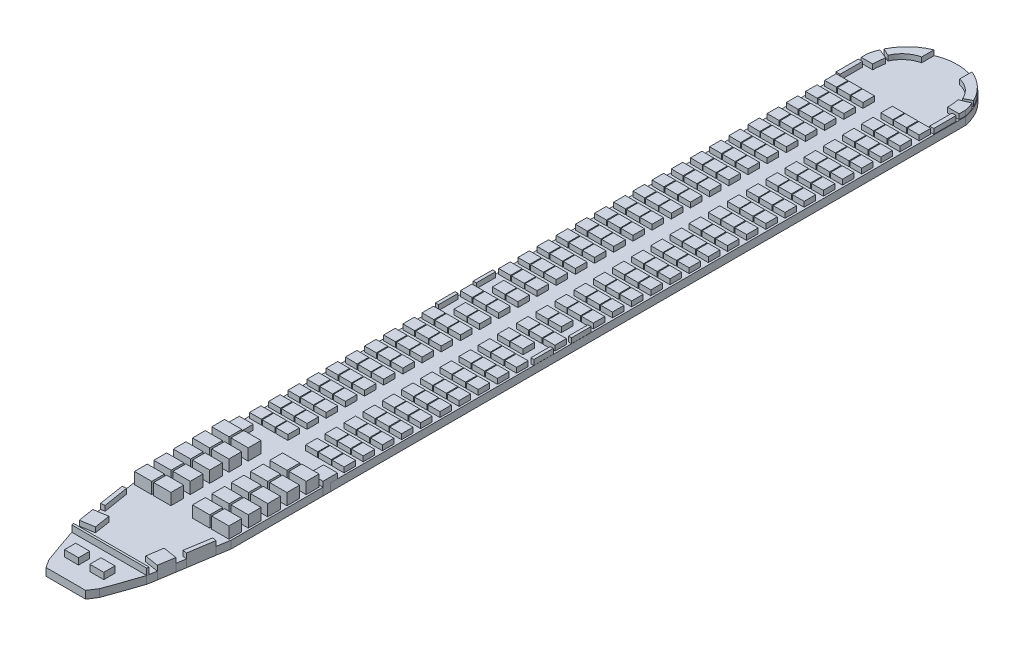
from build123d import *

# Parameters (mm, degrees)
BOSS_EXTRUDE3_DEPTH = 304.8
SKETCH5_W           = 685.8
SKETCH5_H           = 508
SKETCH5_H_2         = 502.441597217
BOSS_EXTRUDE4_DEPTH = 457.2
SKETCH6_W           = 555.14687008
SKETCH6_H           = 574.557168937
SKETCH6_W_2         = 477.661828048
SKETCH6_H_2         = 457.2
SKETCH6_W_3         = 469.71585823
SKETCH6_W_4         = 508
SKETCH6_W_5         = 162.92679119
SKETCH6_H_3         = 889
BOSS_EXTRUDE5_DEPTH = 508
SKETCH7_W           = 555.434575437
SKETCH7_H           = 444.34766035
BOSS_EXTRUDE6_DEPTH = 254


with BuildPart() as part:
    # Sketch4 → Boss-Extrude3 (new body)
    with BuildSketch(Plane(origin=(0, 0, 0), x_dir=(1, 0, 0), z_dir=(0, 1, 0))):
        with BuildLine():
            Line((-788.810799718, -16868.093798918), (788.790469891, -16868.122355126))
            add(Edge.make_bspline(
                [(788.790469891, -16868.122355126), (788.940224397, -16867.911972884), (789.076090363, -16867.721096198), (789.258988166, -16867.464001819), (789.317523873, -16867.381692927), (789.442177508, -16867.206365317), (789.506892185, -16867.115320405), (789.826325262, -16866.665819678), (790.07878684, -16866.310228279), (790.836026476, -16865.242597554), (791.342596004, -16864.526988048), (792.86067741, -16862.378362539), (793.871055668, -16860.942832845), (796.900901382, -16856.621793359), (798.918545553, -16853.722609281), (804.965696638, -16844.970348146), (808.989584152, -16839.062251822), (821.058051486, -16821.109306602), (829.09893792, -16808.835415911), (845.277497053, -16783.650061534), (853.414891385, -16770.738929993), (869.89778139, -16744.281230003), (878.243079484, -16730.735059441), (895.25564514, -16703.044013921), (903.923103805, -16688.899116194), (921.692389055, -16660.082729354), (930.794825428, -16645.410780174), (949.537820712, -16615.646693342), (959.179083326, -16600.554120659), (979.087195904, -16570.083058174), (989.354409106, -16554.704765976), (999.964886864, -16539.261683361)],
                knots=[0, 0, 0, 0, 0.001953125, 0.001953125, 0.002929688, 0.002929688, 0.00390625, 0.00390625, 0.0078125, 0.0078125, 0.015625, 0.015625, 0.03125, 0.03125, 0.0625, 0.0625, 0.125, 0.125, 0.25, 0.25, 0.375, 0.375, 0.5, 0.5, 0.625, 0.625, 0.75, 0.75, 0.875, 0.875, 1, 1, 1, 1], degree=3))
            add(Edge.make_bspline(
                [(999.964886864, -16539.261683361), (1005.469501209, -16525.619062134), (1010.936059612, -16511.929752086), (1021.791388692, -16484.476524628), (1027.181317695, -16470.709753397), (1043.249119015, -16429.282762881), (1053.82117976, -16401.505563933), (1074.725214018, -16345.654468086), (1085.055878667, -16317.584152693), (1105.518671536, -16261.165660069), (1115.650750581, -16232.817545336), (1135.754714917, -16175.87252076), (1145.726299281, -16147.27657481), (1165.552273349, -16089.853455464), (1175.407320544, -16061.024348403), (1195.039760803, -16003.162226824), (1204.817664081, -15974.12777229), (1224.339249807, -15915.870454514), (1234.083292789, -15886.646513956), (1263.324076642, -15798.728848378), (1282.832002714, -15739.782851529), (1312.35844478, -15650.984196085), (1322.244621457, -15621.321265719), (1342.144312918, -15561.889155996), (1352.157331105, -15532.121450588), (1382.446433277, -15442.68476221), (1402.970889639, -15382.889141568), (1429.223854494, -15308.033171222), (1434.504218751, -15293.056542419), (1445.128796407, -15263.09510607), (1450.472611947, -15248.111408218), (1458.540852856, -15225.627655327), (1461.240115841, -15218.12864994), (1466.654125511, -15203.135336201), (1469.368028937, -15195.64335827), (1477.538606754, -15173.161290737), (1483.023616655, -15158.166666964), (1488.546373015, -15143.172978275)],
                knots=[0, 0, 0, 0, 0.03125, 0.03125, 0.0625, 0.0625, 0.125, 0.125, 0.1875, 0.1875, 0.25, 0.25, 0.3125, 0.3125, 0.375, 0.375, 0.4375, 0.4375, 0.5, 0.5, 0.625, 0.625, 0.6875, 0.6875, 0.75, 0.75, 0.875, 0.875, 0.90625, 0.90625, 0.9375, 0.9375, 0.953125, 0.953125, 0.96875, 0.96875, 1, 1, 1, 1], degree=3))
            add(Edge.make_bspline(
                [(1488.546373015, -15143.172978275), (1493.840802249, -15113.383565061), (1499.090128379, -15083.581353073), (1509.506146765, -15023.941400002), (1514.672510127, -14994.105426883), (1530.055031318, -14904.551642146), (1540.15456974, -14844.788189318), (1570.053480056, -14665.330205209), (1589.453191911, -14545.468526341), (1646.586525662, -14185.328356714), (1683.256025742, -13944.496344363), (1756.572562233, -13461.890440047), (1793.220505775, -13220.11318668), (1850.243527614, -12857.124946842), (1869.592488654, -12736.075321596), (1909.309539221, -12493.939565663), (1929.677667902, -12372.853342471), (1950.720285923, -12251.787750663)],
                knots=[0, 0, 0, 0, 0.03125, 0.03125, 0.0625, 0.0625, 0.125, 0.125, 0.25, 0.25, 0.5, 0.5, 0.75, 0.75, 0.875, 0.875, 1, 1, 1, 1], degree=3))
            Line((1950.720285923, -12251.787750663), (1964.85927528, 16931.630930018))
            ThreePointArc((1964.85927528, 16931.630930018), (7.114927686, 18555.0286107), (-1950.629419908, 16931.630930018))
            Line((-1950.629419908, 16931.630930018), (-1950.720285923, -12251.787739666))
            add(Edge.make_bspline(
                [(-1950.720285923, -12251.787739666), (-1929.677422256, -12372.855225305), (-1909.309575273, -12493.939359238), (-1869.592506183, -12736.075197756), (-1850.243553068, -12857.124790715), (-1793.220521061, -13220.113075439), (-1756.572579528, -13461.890326035), (-1683.256037912, -13944.496265516), (-1646.586533763, -14185.328298768), (-1589.453200269, -14545.468477249), (-1570.053488291, -14665.330175444), (-1530.188270947, -14904.607471019), (-1509.722694643, -15024.023194989), (-1488.546377942, -15143.172968001)],
                knots=[0, 0, 0, 0, 0.125, 0.125, 0.25, 0.25, 0.5, 0.5, 0.75, 0.75, 0.875, 0.875, 1, 1, 1, 1], degree=3))
            add(Edge.make_bspline(
                [(-1488.546377942, -15143.172968001), (-1466.455522421, -15203.147143549), (-1444.975296394, -15263.120541687), (-1402.97072655, -15382.889615583), (-1382.446131284, -15442.685654366), (-1342.061332039, -15561.932592068), (-1322.20037424, -15621.385276304), (-1282.83194565, -15739.783041012), (-1263.323845445, -15798.729535593), (-1234.083007528, -15886.647376011), (-1224.338830774, -15915.871706985), (-1204.817585262, -15974.12800532), (-1195.039852061, -16003.1619602), (-1175.407136093, -16061.024889247), (-1165.552038943, -16089.854134348), (-1145.726552787, -16147.275840717), (-1135.754595785, -16175.872863907), (-1105.598236332, -16261.291553641), (-1085.176591865, -16317.730658288), (-1053.820721926, -16401.506772349), (-1043.248965647, -16429.283158333), (-1027.181389759, -16470.709567592), (-1021.791165632, -16484.477101067), (-1010.934766478, -16511.933010335), (-1005.469177826, -16525.61986332), (-999.96488697, -16539.261683105)],
                knots=[0, 0, 0, 0, 0.125, 0.125, 0.25, 0.25, 0.375, 0.375, 0.5, 0.5, 0.5625, 0.5625, 0.625, 0.625, 0.6875, 0.6875, 0.75, 0.75, 0.875, 0.875, 0.9375, 0.9375, 0.96875, 0.96875, 1, 1, 1, 1], degree=3))
            add(Edge.make_bspline(
                [(-999.96488697, -16539.261683105), (-989.354214446, -16554.705050951), (-979.0870972, -16570.083218229), (-959.179297814, -16600.55378496), (-949.538081339, -16615.646278741), (-930.794585603, -16645.411159258), (-921.692516307, -16660.08252605), (-903.923042253, -16688.899211773), (-895.25556778, -16703.044130967), (-878.243061091, -16730.735095132), (-869.897784292, -16744.281226612), (-853.41488483, -16770.738939359), (-845.277447311, -16783.650139102), (-829.098950978, -16808.835395957), (-821.058104775, -16821.109227031), (-808.989532722, -16839.062328265), (-804.965644421, -16844.97042752), (-798.918636468, -16853.722475397), (-796.90109459, -16856.621508099), (-793.365869922, -16861.663300342), (-791.84921569, -16863.814088979), (-790.077825126, -16866.311580325), (-789.824739986, -16866.668060324), (-789.444965093, -16867.202467166), (-789.223411997, -16867.514077762), (-789.001854934, -16867.825427878), (-788.89107346, -16867.981049968), (-788.875171087, -16868.003387727), (-788.843817629, -16868.047426577), (-788.829522774, -16868.067503411), (-788.810799718, -16868.093798918)],
                knots=[0, 0, 0, 0, 0.125, 0.125, 0.25, 0.25, 0.375, 0.375, 0.5, 0.5, 0.625, 0.625, 0.75, 0.75, 0.875, 0.875, 0.9375, 0.9375, 0.96875, 0.96875, 0.9921875, 0.9921875, 0.99609375, 0.99609375, 0.998046875, 0.999511719, 0.999511719, 0.999755859, 0.999755859, 1, 1, 1, 1], degree=3))
        make_face()
    extrude(amount=BOSS_EXTRUDE3_DEPTH)

    # Sketch5 → Boss-Extrude4 (add)
    with BuildSketch(Plane(origin=(0, 304.8, 0), x_dir=(1, 0, 0), z_dir=(0, 1, 0))):
        with Locations((-1536.076796996, -8934.76137586)):
            Rectangle(SKETCH5_W, SKETCH5_H)
        with Locations((-1536.076796996, -9702.713518589)):
            Rectangle(SKETCH5_W, SKETCH5_H)
        with Locations((-774.074929647, -8934.76137586)):
            Rectangle(SKETCH5_W, SKETCH5_H)
        with Locations((-1536.076796996, -10467.886459926)):
            Rectangle(SKETCH5_W, SKETCH5_H_2)
        with Locations((-774.074929647, -9702.713518589)):
            Rectangle(SKETCH5_W, SKETCH5_H)
        with Locations((-774.074929647, -10467.886459926)):
            Rectangle(SKETCH5_W, SKETCH5_H_2)
        with Locations((-1536.076796996, -11238.617804047)):
            Rectangle(SKETCH5_W, SKETCH5_H)
        with Locations((-1536.076796996, -12006.569946776)):
            Rectangle(SKETCH5_W, SKETCH5_H)
        with Locations((-774.074929647, -11238.617804047)):
            Rectangle(SKETCH5_W, SKETCH5_H)
        with Locations((-774.074929647, -12006.569946776)):
            Rectangle(SKETCH5_W, SKETCH5_H)
        with Locations((770.245070353, -8934.76137586)):
            Rectangle(SKETCH5_W, SKETCH5_H)
        with Locations((770.245070353, -9702.713518589)):
            Rectangle(SKETCH5_W, SKETCH5_H)
        with Locations((1532.246937703, -8934.76137586)):
            Rectangle(SKETCH5_W, SKETCH5_H)
        with Locations((770.245070353, -10467.886459926)):
            Rectangle(SKETCH5_W, SKETCH5_H_2)
        with Locations((1532.246937703, -9702.713518589)):
            Rectangle(SKETCH5_W, SKETCH5_H)
        with Locations((770.245070353, -11238.617804047)):
            Rectangle(SKETCH5_W, SKETCH5_H)
        with Locations((1532.246937703, -10467.886459926)):
            Rectangle(SKETCH5_W, SKETCH5_H_2)
        with Locations((770.245070353, -12006.569946776)):
            Rectangle(SKETCH5_W, SKETCH5_H)
        with Locations((1532.246937703, -11238.617804047)):
            Rectangle(SKETCH5_W, SKETCH5_H)
        with Locations((1532.246937703, -12006.569946776)):
            Rectangle(SKETCH5_W, SKETCH5_H)
    extrude(amount=BOSS_EXTRUDE4_DEPTH)

    # Sketch6 → Boss-Extrude5 (add)
    with BuildSketch(Plane(origin=(0, 0, 0), x_dir=(1, 0, 0), z_dir=(0, 1, 0))):
        with BuildLine():
            Line((-1096.996372185, -14059.412556752), (-1652.936881784, -14145.735054556))
            add(Edge.make_bspline(
                [(-1652.936881784, -14145.735054556), (-1638.441172727, -14239.091387896), (-1623.814093179, -14332.352073131), (-1589.89619163, -14545.241668657), (-1570.465580892, -14664.797558908), (-1550.505259066, -14784.131230852)],
                knots=[0.652996975, 0.652996975, 0.652996975, 0.652996975, 0.75, 0.75, 0.874694016, 0.874694016, 0.874694016, 0.874694016], degree=3))
            Line((-1550.505259066, -14784.131230852), (-998.796019918, -14691.849699677))
            Line((-998.796019918, -14691.849699677), (-1096.996372185, -14059.412556752))
        make_face()
        with BuildLine():
            add(Edge.make_bspline(
                [(-1866.570853309, -12765.872272948), (-1855.131474123, -12836.711221148), (-1843.842752296, -12907.538994798), (-1794.495192893, -13220.31545729), (-1757.686992517, -13462.068361946), (-1716.805347843, -13729.975608952), (-1712.741785405, -13756.598502636), (-1708.676197232, -13783.215299013)],
                knots=[0.176839669, 0.176839669, 0.176839669, 0.176839669, 0.25, 0.25, 0.5, 0.5, 0.527591162, 0.527591162, 0.527591162, 0.527591162], degree=3))
            Line((-1708.676197232, -13783.215299013), (-1546.116197232, -13758.385037546))
            Line((-1546.116197232, -13758.385037546), (-1710.462314607, -12740.663192156))
            Line((-1710.462314607, -12740.663192156), (-1866.570853309, -12765.872272948))
        make_face()
        with Locations((-1675.063361956, -8311.235137432)):
            Rectangle(SKETCH6_W, SKETCH6_H)
        with Locations((-593.807425389, -7461.005527647)):
            Rectangle(SKETCH6_W_2, SKETCH6_H_2)
        with Locations((-593.807425389, -6699.005527647)):
            Rectangle(SKETCH6_W_2, SKETCH6_H_2)
        with Locations((-1644.118867881, -7461.005527647)):
            Rectangle(SKETCH6_W_3, SKETCH6_H_2)
        with Locations((-1116.976796996, -7461.005527647)):
            Rectangle(SKETCH6_W_4, SKETCH6_H_2)
        with Locations((-593.807425389, -5937.005527647)):
            Rectangle(SKETCH6_W_2, SKETCH6_H_2)
        with Locations((-593.807425389, -5175.005527647)):
            Rectangle(SKETCH6_W_2, SKETCH6_H_2)
        with Locations((-1116.976796996, -6699.005527647)):
            Rectangle(SKETCH6_W_4, SKETCH6_H_2)
        with Locations((-1644.118867881, -6699.005527647)):
            Rectangle(SKETCH6_W_3, SKETCH6_H_2)
        with Locations((-593.807425389, -4413.005527647)):
            Rectangle(SKETCH6_W_2, SKETCH6_H_2)
        with Locations((-1116.976796996, -5937.005527647)):
            Rectangle(SKETCH6_W_4, SKETCH6_H_2)
        with Locations((-593.807425389, -3651.005527647)):
            Rectangle(SKETCH6_W_2, SKETCH6_H_2)
        with Locations((-1116.976796996, -5175.005527647)):
            Rectangle(SKETCH6_W_4, SKETCH6_H_2)
        with Locations((-1644.118867881, -5937.005527647)):
            Rectangle(SKETCH6_W_3, SKETCH6_H_2)
        with Locations((-593.807425389, -2889.005527647)):
            Rectangle(SKETCH6_W_2, SKETCH6_H_2)
        with Locations((-1116.976796996, -4413.005527647)):
            Rectangle(SKETCH6_W_4, SKETCH6_H_2)
        with Locations((-593.807425389, -2127.005527647)):
            Rectangle(SKETCH6_W_2, SKETCH6_H_2)
        with Locations((-1116.976796996, -3651.005527647)):
            Rectangle(SKETCH6_W_4, SKETCH6_H_2)
        with Locations((-1644.118867881, -5175.005527647)):
            Rectangle(SKETCH6_W_3, SKETCH6_H_2)
        with Locations((-593.807425389, -1365.005527647)):
            Rectangle(SKETCH6_W_2, SKETCH6_H_2)
        with Locations((-1116.976796996, -2889.005527647)):
            Rectangle(SKETCH6_W_4, SKETCH6_H_2)
        with Locations((-1644.118867881, -4413.005527647)):
            Rectangle(SKETCH6_W_3, SKETCH6_H_2)
        with Locations((-593.807425389, -603.005527647)):
            Rectangle(SKETCH6_W_2, SKETCH6_H_2)
        with Locations((-1116.976796996, -2127.005527647)):
            Rectangle(SKETCH6_W_4, SKETCH6_H_2)
        with Locations((-1644.118867881, -3651.005527647)):
            Rectangle(SKETCH6_W_3, SKETCH6_H_2)
        with Locations((-1116.976796996, -1365.005527647)):
            Rectangle(SKETCH6_W_4, SKETCH6_H_2)
        with Locations((-1644.118867881, -2889.005527647)):
            Rectangle(SKETCH6_W_3, SKETCH6_H_2)
        with Locations((-593.807425389, 158.994472353)):
            Rectangle(SKETCH6_W_2, SKETCH6_H_2)
        with Locations((-1116.976796996, -603.005527647)):
            Rectangle(SKETCH6_W_4, SKETCH6_H_2)
        with Locations((-1644.118867881, -2127.005527647)):
            Rectangle(SKETCH6_W_3, SKETCH6_H_2)
        with Locations((-1644.118867881, -1365.005527647)):
            Rectangle(SKETCH6_W_3, SKETCH6_H_2)
        with Locations((-593.807425389, 920.994472353)):
            Rectangle(SKETCH6_W_2, SKETCH6_H_2)
        with Locations((-1116.976796996, 158.994472353)):
            Rectangle(SKETCH6_W_4, SKETCH6_H_2)
        with Locations((-1644.118867881, -603.005527647)):
            Rectangle(SKETCH6_W_3, SKETCH6_H_2)
        with Locations((-593.807425389, 1682.994472353)):
            Rectangle(SKETCH6_W_2, SKETCH6_H_2)
        with Locations((-1116.976796996, 920.994472353)):
            Rectangle(SKETCH6_W_4, SKETCH6_H_2)
        with Locations((-593.807425389, 2444.994472353)):
            Rectangle(SKETCH6_W_2, SKETCH6_H_2)
        with Locations((-1116.976796996, 1682.994472353)):
            Rectangle(SKETCH6_W_4, SKETCH6_H_2)
        with Locations((-1644.118867881, 920.994472353)):
            Rectangle(SKETCH6_W_3, SKETCH6_H_2)
        Polygon((-1952.636796996, -69.605527647), (-1952.636796996, -219.786775868), (-1831.0610289, -219.786775868), (-1831.0610289, 554.001006805), (-1952.636796996, 554.001006805), (-1952.636796996, 387.594472353), align=None)
        with Locations((-593.807425389, 3206.994472353)):
            Rectangle(SKETCH6_W_2, SKETCH6_H_2)
        with Locations((-1116.976796996, 2444.994472353)):
            Rectangle(SKETCH6_W_4, SKETCH6_H_2)
        with Locations((-593.807425389, 5492.994472353)):
            Rectangle(SKETCH6_W_2, SKETCH6_H_2)
        with Locations((-593.807425389, 3968.994472353)):
            Rectangle(SKETCH6_W_2, SKETCH6_H_2)
        with Locations((-593.807425389, 6254.994472353)):
            Rectangle(SKETCH6_W_2, SKETCH6_H_2)
        with Locations((-593.807425389, 4730.994472353)):
            Rectangle(SKETCH6_W_2, SKETCH6_H_2)
        with Locations((-1116.976796996, 3206.994472353)):
            Rectangle(SKETCH6_W_4, SKETCH6_H_2)
        with Locations((-1644.118867881, 2444.994472353)):
            Rectangle(SKETCH6_W_3, SKETCH6_H_2)
        with Locations((-593.807425389, 7016.994472353)):
            Rectangle(SKETCH6_W_2, SKETCH6_H_2)
        with Locations((-1116.976796996, 5492.994472353)):
            Rectangle(SKETCH6_W_4, SKETCH6_H_2)
        with Locations((-1116.976796996, 3968.994472353)):
            Rectangle(SKETCH6_W_4, SKETCH6_H_2)
        Polygon((-1952.636796996, 1454.394472353), (-1952.636796996, 1275.769351062), (-1831.0610289, 1275.769351062), (-1831.0610289, 2049.557133735), (-1952.636796996, 2049.557133735), (-1952.636796996, 1911.594472353), align=None)
        with Locations((-593.807425389, 7778.994472353)):
            Rectangle(SKETCH6_W_2, SKETCH6_H_2)
        with Locations((-1116.976796996, 6254.994472353)):
            Rectangle(SKETCH6_W_4, SKETCH6_H_2)
        with Locations((-1116.976796996, 4730.994472353)):
            Rectangle(SKETCH6_W_4, SKETCH6_H_2)
        with Locations((-1644.118867881, 3206.994472353)):
            Rectangle(SKETCH6_W_3, SKETCH6_H_2)
        with Locations((-593.807425389, 8540.994472353)):
            Rectangle(SKETCH6_W_2, SKETCH6_H_2)
        with Locations((-1116.976796996, 7016.994472353)):
            Rectangle(SKETCH6_W_4, SKETCH6_H_2)
        with Locations((-1644.118867881, 5492.994472353)):
            Rectangle(SKETCH6_W_3, SKETCH6_H_2)
        with Locations((-1644.118867881, 3968.994472353)):
            Rectangle(SKETCH6_W_3, SKETCH6_H_2)
        with Locations((-593.807425389, 9302.994472353)):
            Rectangle(SKETCH6_W_2, SKETCH6_H_2)
        with Locations((-1116.976796996, 7778.994472353)):
            Rectangle(SKETCH6_W_4, SKETCH6_H_2)
        with Locations((-1644.118867881, 6254.994472353)):
            Rectangle(SKETCH6_W_3, SKETCH6_H_2)
        with Locations((-1644.118867881, 4730.994472353)):
            Rectangle(SKETCH6_W_3, SKETCH6_H_2)
        with Locations((-1116.976796996, 8540.994472353)):
            Rectangle(SKETCH6_W_4, SKETCH6_H_2)
        with Locations((-593.807425389, 10064.994472353)):
            Rectangle(SKETCH6_W_2, SKETCH6_H_2)
        with Locations((-1644.118867881, 7016.994472353)):
            Rectangle(SKETCH6_W_3, SKETCH6_H_2)
        with Locations((-1116.976796996, 9302.994472353)):
            Rectangle(SKETCH6_W_4, SKETCH6_H_2)
        with Locations((-593.807425389, 10826.994472353)):
            Rectangle(SKETCH6_W_2, SKETCH6_H_2)
        with Locations((-1644.118867881, 7778.994472353)):
            Rectangle(SKETCH6_W_3, SKETCH6_H_2)
        with Locations((-1644.118867881, 8540.994472353)):
            Rectangle(SKETCH6_W_3, SKETCH6_H_2)
        with Locations((-1116.976796996, 10064.994472353)):
            Rectangle(SKETCH6_W_4, SKETCH6_H_2)
        with BuildLine():
            Line((-756.552134503, 17904.31606865), (-756.552134503, 18392.105297286))
            ThreePointArc((-756.552134503, 18392.105297286), (-1354.885694403, 18005.764566755), (-1779.102756631, 17433.661347848))
            Line((-1779.102756631, 17433.661347848), (-1488.546377942, 17290.307318719))
            ThreePointArc((-1488.546377942, 17290.307318719), (-1195.240690859, 17683.971226969), (-756.552134503, 17904.31606865))
        make_face()
        with Locations((-593.807425389, 11588.994472353)):
            Rectangle(SKETCH6_W_2, SKETCH6_H_2)
        with Locations((-1644.118867881, 9302.994472353)):
            Rectangle(SKETCH6_W_3, SKETCH6_H_2)
        with Locations((-593.807425389, 12350.994472353)):
            Rectangle(SKETCH6_W_2, SKETCH6_H_2)
        with Locations((-1116.976796996, 10826.994472353)):
            Rectangle(SKETCH6_W_4, SKETCH6_H_2)
        with Locations((-1644.118867881, 10064.994472353)):
            Rectangle(SKETCH6_W_3, SKETCH6_H_2)
        with BuildLine():
            Line((-1441.046326867, 17156.662264731), (-1831.0610289, 17319.415601262))
            ThreePointArc((-1831.0610289, 17319.415601262), (-1896.971911783, 17136.940595209), (-1944.821975188, 16948.920001261))
            Line((-1944.821975188, 16948.920001261), (-1944.821975188, 16690.823487294))
            Line((-1944.821975188, 16690.823487294), (-1487.376802717, 16690.823487294))
            ThreePointArc((-1487.376802717, 16690.823487294), (-1474.526145637, 16924.768723284), (-1441.046326867, 17156.662264731))
        make_face()
        with Locations((-593.807425389, 13112.994472353)):
            Rectangle(SKETCH6_W_2, SKETCH6_H_2)
        with Locations((-1116.976796996, 11588.994472353)):
            Rectangle(SKETCH6_W_4, SKETCH6_H_2)
        with Locations((-593.807425389, 13874.994472353)):
            Rectangle(SKETCH6_W_2, SKETCH6_H_2)
        with Locations((-1116.976796996, 12350.994472353)):
            Rectangle(SKETCH6_W_4, SKETCH6_H_2)
        with Locations((-1644.118867881, 10826.994472353)):
            Rectangle(SKETCH6_W_3, SKETCH6_H_2)
        with Locations((-593.807425389, 14636.994472353)):
            Rectangle(SKETCH6_W_2, SKETCH6_H_2)
        with Locations((-1116.976796996, 13112.994472353)):
            Rectangle(SKETCH6_W_4, SKETCH6_H_2)
        with Locations((-1644.118867881, 11588.994472353)):
            Rectangle(SKETCH6_W_3, SKETCH6_H_2)
        with Locations((-1863.358579593, 16128.656097205)):
            Rectangle(SKETCH6_W_5, SKETCH6_H_3)
        with Locations((-593.807425389, 15398.994472353)):
            Rectangle(SKETCH6_W_2, SKETCH6_H_2)
        with Locations((-1116.976796996, 13874.994472353)):
            Rectangle(SKETCH6_W_4, SKETCH6_H_2)
        with Locations((-1644.118867881, 12350.994472353)):
            Rectangle(SKETCH6_W_3, SKETCH6_H_2)
        with Locations((-1116.976796996, 14636.994472353)):
            Rectangle(SKETCH6_W_4, SKETCH6_H_2)
        with Locations((-1644.118867881, 13112.994472353)):
            Rectangle(SKETCH6_W_3, SKETCH6_H_2)
        with Locations((-1116.976796996, 15398.994472353)):
            Rectangle(SKETCH6_W_4, SKETCH6_H_2)
        with Locations((-1644.118867881, 13874.994472353)):
            Rectangle(SKETCH6_W_3, SKETCH6_H_2)
        with Locations((-1644.118867881, 15398.994472353)):
            Rectangle(SKETCH6_W_3, SKETCH6_H_2)
        with Locations((-1644.118867881, 14636.994472353)):
            Rectangle(SKETCH6_W_3, SKETCH6_H_2)
    boss_extrude5 = extrude(amount=BOSS_EXTRUDE5_DEPTH)

    # Mirror1: Boss-Extrude5 across plane
    add(boss_extrude5.mirror(Plane(origin=(0, 0, 0), x_dir=(0, 0, 1), z_dir=(1, 0, 0))))

    # Sketch7 → Boss-Extrude6 (add)
    with BuildSketch(Plane(origin=(0, 304.8, 0), x_dir=(1, 0, 0), z_dir=(0, 1, 0))):
        Polygon((-1503.586624794, -15057.833789755), (-1488.546377942, -15143.172968001), (1488.546373015, -15143.172978275), (1503.586620954, -15057.833789755), align=None)
        with Locations((-502.188780239, -15918.149295169)):
            Rectangle(SKETCH7_W, SKETCH7_H)
        Polygon((224.459738164, -16140.325770221), (779.894313562, -16140.332314903), (779.899549308, -15695.984654584), (224.464973909, -15695.978109902), align=None)
    extrude(amount=BOSS_EXTRUDE6_DEPTH)


solid = part.part
